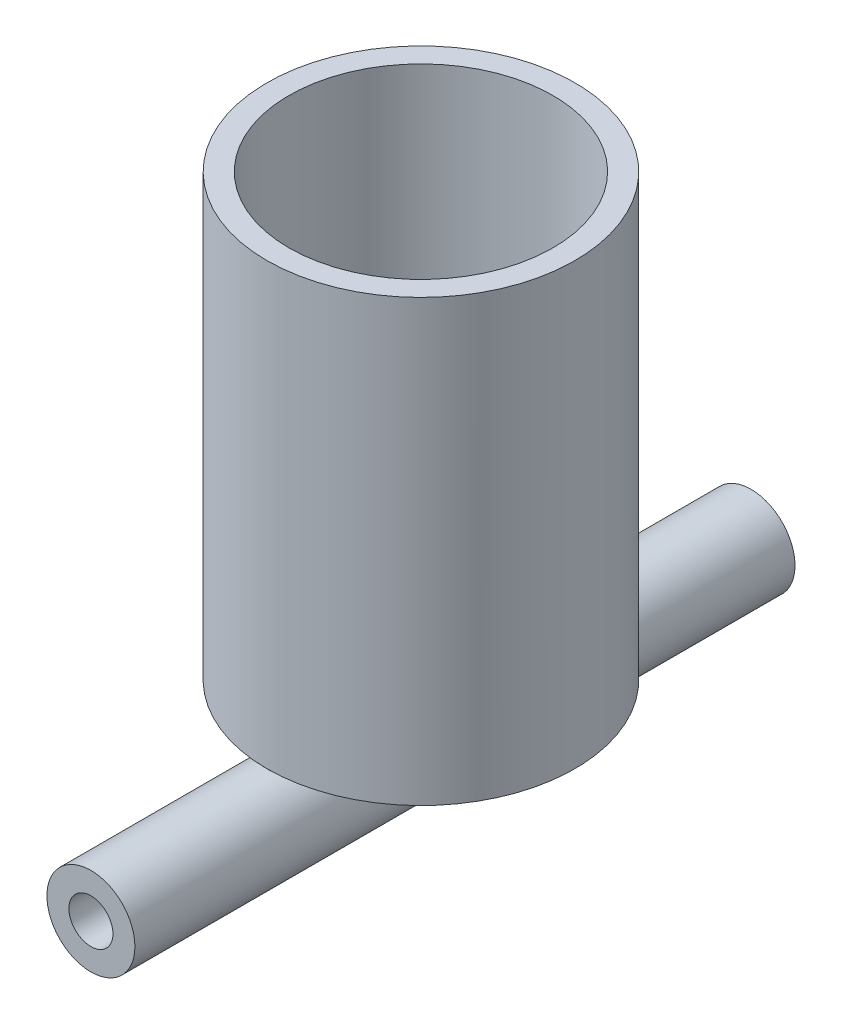
from build123d import *
from build123d.topology import SkipClean

# Parameters (mm, degrees)
SKETCH1_R           = 70
SKETCH1_R_2         = 59.99999999999999
BOSS_EXTRUDE1_DEPTH = 200
SKETCH2_R           = 20.000000000000018
SKETCH2_R_2         = 10.00000000000001
BOSS_EXTRUDE2_DEPTH = 150


with BuildPart() as part:
    # Sketch1 → Boss-Extrude1 (new body)
    with BuildSketch(Plane(origin=(0, 0, 0), x_dir=(1, 0, 0), z_dir=(0, 1, 0))):
        Circle(SKETCH1_R)
        Circle(SKETCH1_R_2, mode=Mode.SUBTRACT)
    extrude(amount=BOSS_EXTRUDE1_DEPTH)



with BuildPart() as body_2:
    # Sketch2 → Boss-Extrude2 (new, symmetric)
    with BuildSketch(Plane.XY):
        with Locations((2.694e-14, -20.000000000000004)):
            Circle(SKETCH2_R)
        with Locations((2.694e-14, -20.000000000000004)):
            Circle(SKETCH2_R_2, mode=Mode.SUBTRACT)
    extrude(amount=BOSS_EXTRUDE2_DEPTH, both=True)


with BuildPart() as part_1:
    with SkipClean():  # the faces are left unmerged after this step: merging them gives an invalid solid
        add(part.part)

        add(body_2.part)  # Revolve2 merges body 2
        # Sketch3 → Revolve2 (revolve)
        with BuildSketch(Plane.XY):
            with BuildLine():
                Line((69.99999999999999, 0), (10.633553756512946, -36.93893545968432))
                ThreePointArc((10.633553756512946, -36.93893545968432), (17.659776614987702, -29.38787994750335), (19.989106080924817, -19.339971147951626))
                Line((19.989106080924817, -19.339971147951626), (51.0713596222745, -8.7e-16))
                Line((51.0713596222745, -8.7e-16), (69.99999999999999, 0))
            make_face()
        revolve(axis=Axis((2.694e-14, 0, 0), (0, -1, 0)))


solid = part_1.part
